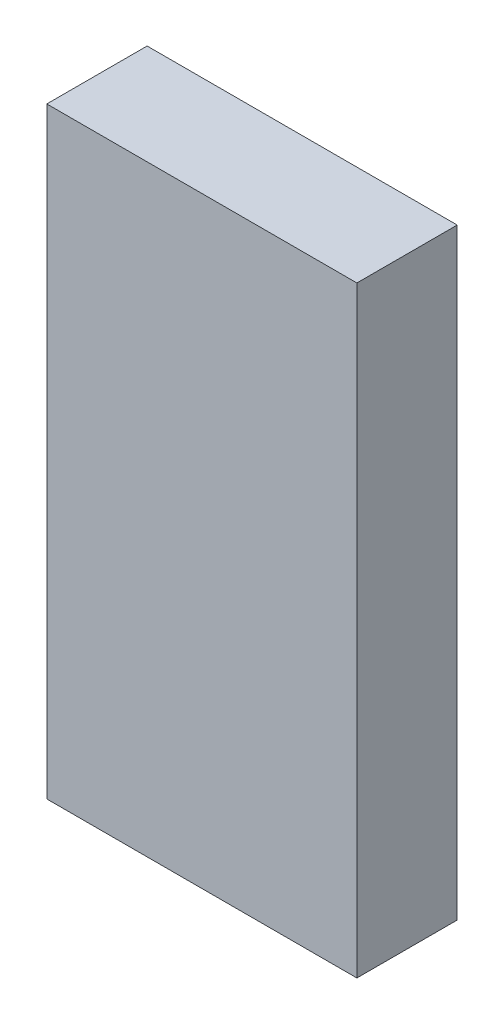
from build123d import *

# Parameters (mm, degrees)
SKETCH3_W           = 34
SKETCH3_H           = 66
BOSS_EXTRUDE3_DEPTH = 11


with BuildPart() as part:
    # Sketch3 → Boss-Extrude3 (new body)
    with BuildSketch(Plane.XY):
        with Locations((17, 0)):
            Rectangle(SKETCH3_W, SKETCH3_H)
    extrude(amount=-BOSS_EXTRUDE3_DEPTH)


solid = part.part
